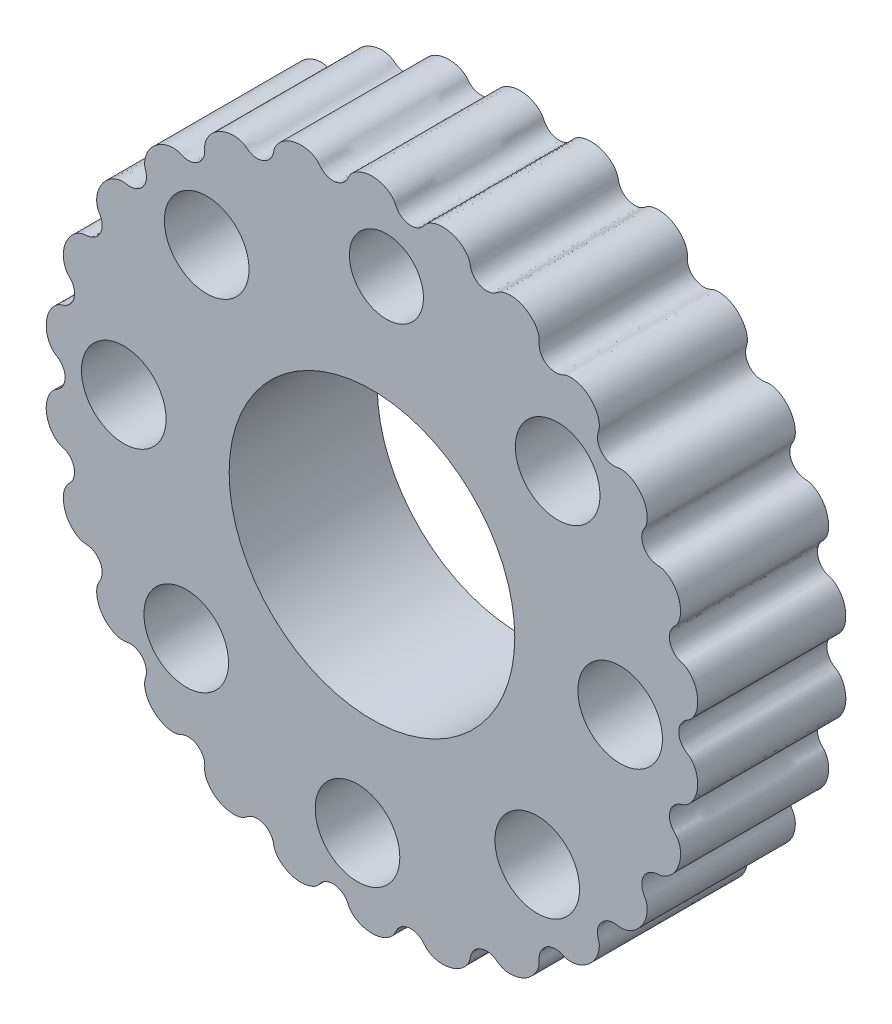
from build123d import *

# Parameters (mm, degrees)
SKETCH1_R        = 4
SKETCH1_R_2      = 13.5
EXTRUSION1_DEPTH = 14
EXTRUSION2_START = -5
SKETCH2_R        = 4
SKETCH2_R_2      = 3.5
EXTRUSION2_DEPTH = 5


with BuildPart() as part:
    # Sketch1 → Extrusion1 (new body)
    with BuildSketch(Plane.XY):
        with BuildLine():
            add(Edge.make_bspline(
                [(29, 0), (29, -0.376789204), (29.153513259, -0.703229563), (29.280402525, -0.883905996), (29.495133495, -1.189659407), (29.623510818, -1.242583836), (29.700019426, -1.295833756), (29.854226598, -1.403161804), (29.88265414, -1.412994243), (29.934648255, -1.448461782), (30.057359745, -1.532168844), (30.226573766, -1.667269836), (30.408052145, -1.955494437), (30.663331992, -2.360930792), (30.861446732, -3.06680081), (30.770659289, -3.762971134), (30.689739184, -4.383477382), (30.390255046, -4.954513185), (30.079404167, -5.289719413), (29.850529622, -5.536526414), (29.636586178, -5.660425735), (29.495438805, -5.723227119), (29.422146843, -5.755837266), (29.378667255, -5.76961159), (29.272559274, -5.805016474), (29.218748124, -5.822971556), (29.153849, -5.834396348), (28.970346246, -5.927674104), (28.848691254, -5.989513529), (28.638295722, -6.083579397), (28.402421601, -6.410574806), (28.230156467, -6.649388237), (28.101415723, -7.043920043), (28.114039967, -7.36632783), (28.13003751, -7.774885561), (28.272102362, -8.005844612), (28.356127129, -8.139006604), (28.505739094, -8.37611083), (28.568168114, -8.412323093), (28.612595809, -8.458659561), (28.711235488, -8.561537154), (28.744398474, -8.593760135), (28.808819097, -8.681895487), (28.948574282, -8.873097803), (29.151409878, -9.278419137), (29.175326567, -9.843287507), (29.201561715, -10.46291363), (28.968447422, -11.222843927), (28.567285081, -11.744523122), (28.224165345, -12.1907226), (27.796219964, -12.449058071), (27.512031378, -12.550259379), (27.358832379, -12.604814488), (27.25436537, -12.621049722), (27.158265381, -12.631046232), (27.099367254, -12.637172931), (27.067709293, -12.631488341), (26.873148531, -12.658460721), (26.788179826, -12.670240117), (26.665632167, -12.675675152), (26.416933975, -12.786433586), (26.232928362, -12.868380998), (25.946653249, -13.043759284), (25.740420799, -13.36934038), (25.544926925, -13.677968382), (25.489822974, -14.056912498), (25.506535744, -14.297475966), (25.533815346, -14.690138321), (25.631337693, -14.820256217), (25.67726007, -14.913047886), (25.767155033, -15.094691436), (25.790803082, -15.117574356), (25.819020041, -15.168683178), (25.885780874, -15.289605762), (25.95872212, -15.440829308), (26.000279455, -15.72147703), (26.063492675, -16.148372702), (25.978321637, -16.838256473), (25.624035928, -17.435865816), (25.273534038, -18.02709261), (24.684736969, -18.474969864), (24.204873828, -18.651888643), (23.850532913, -18.782529145), (23.58391245, -18.786530914), (23.423692808, -18.772306679), (23.353178507, -18.766046447), (23.313475257, -18.757998242), (23.193003065, -18.739109801), (23.130493718, -18.729309164), (23.057050179, -18.70439141), (22.817016308, -18.712748042), (22.665973243, -18.718006514), (22.411735467, -18.728224886), (22.074129263, -18.927651904), (21.803689676, -19.087402998), (21.537010762, -19.406590813), (21.426735852, -19.688830845), (21.270305731, -20.08920154), (21.316386948, -20.33233582), (21.33515342, -20.472892432), (21.369718287, -20.731775427), (21.400821881, -20.775045), (21.417284821, -20.831424873), (21.455421255, -20.96202896), (21.476017723, -21.033714564), (21.487059708, -21.194003219), (21.507665593, -21.493124234), (21.431991893, -22.035100014), (21.10046464, -22.56382238), (20.752479983, -23.118791147), (20.128266089, -23.598189384), (19.544493143, -23.790530755), (19.083278307, -23.942491709), (18.676784908, -23.930558237), (18.43738774, -23.882676974), (18.318275954, -23.858853706), (18.241679923, -23.831464215), (18.164838876, -23.800204857), (18.115287483, -23.78004708), (18.082088593, -23.759876823), (17.930173703, -23.703609039), (17.850190596, -23.673984081), (17.742072817, -23.617835381), (17.451890523, -23.598582777), (17.253236248, -23.585402744), (16.923751511, -23.605534598), (16.591139818, -23.793192282), (16.282780206, -23.967167077), (16.05488253, -24.265673436), (15.953178452, -24.485269327), (15.786354747, -24.84546924), (15.809506746, -25.014628377), (15.806088543, -25.121749654), (15.799481943, -25.328790473), (15.81061611, -25.361861802), (15.812109447, -25.418971328), (15.815641201, -25.554035759), (15.812406055, -25.704405001), (15.732664746, -25.953731572), (15.607596852, -26.344780447), (15.243418072, -26.912408891), (14.671037963, -27.292431394), (14.124718948, -27.655151056), (13.42767167, -27.814510539), (12.907715387, -27.778307624), (12.495865692, -27.74963183), (12.212478405, -27.625271416), (12.057583055, -27.532907426), (11.988100522, -27.49147504), (11.948201973, -27.461630149), (11.870914875, -27.403273336), (11.823322443, -27.367337937), (11.788753906, -27.319248435), (11.557639229, -27.198239248), (11.43929978, -27.13627797), (11.250146468, -27.031373812), (10.886678744, -27.017194857), (10.598987922, -27.005971975), (10.201432566, -27.111664102), (9.935629849, -27.301878904), (9.626564783, -27.523053281), (9.501689158, -27.761846503), (9.432870859, -27.908688978), (9.30095485, -28.190167505), (9.309619898, -28.270298288), (9.295631034, -28.337455332), (9.264435305, -28.487218252), (9.258552966, -28.527575136), (9.224995758, -28.627127141), (9.152563358, -28.842007673), (8.951268439, -29.22455999), (8.521291306, -29.564825082), (8.051312694, -29.936745595), (7.321670629, -30.195315854), (6.666548374, -30.18551273), (6.149536286, -30.17777626), (5.701998643, -30.01979544), (5.427983165, -29.85547943), (5.231722981, -29.737790128), (5.125408156, -29.631831284), (5.048933185, -29.544996261), (5.010375025, -29.501214633), (4.989516803, -29.470409418), (4.8984967, -29.364093053), (4.848368887, -29.305541078), (4.796999006, -29.214894746), (4.548899507, -29.046357174), (4.399181678, -28.944651691), (4.136411234, -28.798161464), (3.755673, -28.779285334), (3.414405592, -28.762366078), (3.042716869, -28.891985111), (2.824551091, -29.038709227), (2.484387171, -29.26748136), (2.405597414, -29.447359704), (2.344575844, -29.549095179), (2.22972714, -29.740571529), (2.224096245, -29.781013939), (2.199893849, -29.831433208), (2.143040371, -29.949872339), (2.090804872, -30.050667939), (1.948163151, -30.209644586), (1.704155366, -30.48159545), (1.181104411, -30.83769535), (0.518371049, -30.95472865), (-0.143255115, -31.071566429), (-0.891215069, -30.925579479), (-1.383857125, -30.651354116), (-1.724356119, -30.461818004), (-1.942342037, -30.234234972), (-2.058694069, -30.072741656), (-2.132811533, -29.969868721), (-2.164149671, -29.907017862), (-2.210380122, -29.809426793), (-2.229700089, -29.768642932), (-2.247192336, -29.723553138), (-2.308596707, -29.611786605), (-2.353963805, -29.529210671), (-2.403608644, -29.398358825), (-2.648504122, -29.176526635), (-2.811364542, -29.029003764), (-3.114843055, -28.83641096), (-3.489126798, -28.789352791), (-3.851241679, -28.743824595), (-4.188506196, -28.847742856), (-4.384723272, -28.948769214), (-4.717099561, -29.119899915), (-4.791674777, -29.244772824), (-4.856233022, -29.316051809), (-4.983929976, -29.457042464), (-4.997746831, -29.485760536), (-5.036905099, -29.53118873), (-5.133461533, -29.643205544), (-5.275985883, -29.78775877), (-5.572511333, -29.934209596), (-5.981254164, -30.136083415), (-6.669097215, -30.263104747), (-7.337150557, -30.118112097), (-8.005422406, -29.973072023), (-8.599322793, -29.565327432), (-8.90670342, -29.186424709), (-9.108385875, -28.937814273), (-9.197225057, -28.722791811), (-9.23961282, -28.581181709), (-9.25829201, -28.518777803), (-9.268174338, -28.472926288), (-9.283174683, -28.39863402), (-9.292241027, -28.3537311), (-9.298811144, -28.302862183), (-9.334414747, -28.175648604), (-9.36147998, -28.078943076), (-9.383274666, -27.927568033), (-9.586375382, -27.648595316), (-9.724085585, -27.459440937), (-10.002669302, -27.203566404), (-10.358057207, -27.08939079), (-10.712288342, -26.975586811), (-11.047428124, -27.018036104), (-11.247271358, -27.074370779), (-11.607160156, -27.175821391), (-11.690494591, -27.273289118), (-11.763091617, -27.324129438), (-11.91443087, -27.430113614), (-11.9326436, -27.451277308), (-11.990494242, -27.490297087), (-12.126510685, -27.582039053), (-12.364031199, -27.711242846), (-12.762304293, -27.763719538), (-13.262518248, -27.829628016), (-13.979986828, -27.712548347), (-14.561666645, -27.361677552), (-15.142387956, -27.01138493), (-15.544189918, -26.459983693), (-15.698654591, -26.05121109), (-15.795993367, -25.793615459), (-15.811648643, -25.609789997), (-15.812728579, -25.480621977), (-15.813143796, -25.430958983), (-15.811194859, -25.390583128), (-15.808098369, -25.314809119), (-15.80603082, -25.264214284), (-15.798697321, -25.203924251), (-15.809876958, -25.048307991), (-15.818162357, -24.932978399), (-15.817266226, -24.750262954), (-15.978009681, -24.434133715), (-16.092933598, -24.208116362), (-16.34396621, -23.916340633), (-16.652752822, -23.760262264), (-17.009927335, -23.57972589), (-17.333182061, -23.58392321), (-17.521203248, -23.604713619), (-17.853387005, -23.641444778), (-17.932654993, -23.703306136), (-18.00367317, -23.732275098), (-18.156071724, -23.794439858), (-18.183843461, -23.810305706), (-18.262019218, -23.836355439), (-18.440426314, -23.895804269), (-18.775676263, -23.962903754), (-19.236779227, -23.871624394), (-19.773156003, -23.765443924), (-20.426775322, -23.406126011), (-20.85810381, -22.895418828), (-21.286151212, -22.388596558), (-21.47085206, -21.779570597), (-21.488930141, -21.394614583), (-21.500621317, -21.145661823), (-21.468865946, -21.013759747), (-21.431565807, -20.881029713), (-21.419598524, -20.838444941), (-21.405336227, -20.798008705), (-21.378065716, -20.691137708), (-21.358368957, -20.613947657), (-21.314606088, -20.512619306), (-21.320946107, -20.221114476), (-21.325157041, -20.027501856), (-21.367726323, -19.699302641), (-21.596507682, -19.37075596), (-21.805015671, -19.071323315), (-22.144668616, -18.865630978), (-22.383630568, -18.788290041), (-22.775331784, -18.661514466), (-22.938900049, -18.709912643), (-23.044907923, -18.72000009), (-23.244105229, -18.738955212), (-23.275722221, -18.753159272), (-23.332294806, -18.761415327), (-23.470632783, -18.781604011), (-23.633917403, -18.796910673), (-23.910368317, -18.73778214), (-24.317955011, -18.650605712), (-24.911212213, -18.348260848), (-25.344006425, -17.831383438), (-25.776274137, -17.315134817), (-26.009005348, -16.620732001), (-26.022312378, -16.099736428), (-26.030488039, -15.779643688), (-25.971521912, -15.531144499), (-25.912768729, -15.372231853), (-25.879445986, -15.282102182), (-25.848804962, -15.221918981), (-25.813525479, -15.158792832), (-25.79076123, -15.118060394), (-25.767720937, -15.0833216), (-25.712862173, -14.981763959), (-25.678735759, -14.918587213), (-25.623775022, -14.838440372), (-25.560344984, -14.609836108), (-25.515341819, -14.447642989), (-25.45606319, -14.173517302), (-25.552037739, -13.803688322), (-25.638692263, -13.469773193), (-25.891757905, -13.130612652), (-26.118413124, -12.961295021), (-26.446587443, -12.716139852), (-26.652479534, -12.698358105), (-26.773903808, -12.674868854), (-26.998785053, -12.631366088), (-27.042788745, -12.641056046), (-27.098481374, -12.636501344), (-27.234209956, -12.625401073), (-27.335712061, -12.614944718), (-27.526823798, -12.544915294), (-27.851146092, -12.426073282), (-28.353695378, -12.095384857), (-28.706603378, -11.546591504), (-29.06035764, -10.99648216), (-29.221901536, -10.261461854), (-29.164411473, -9.690095777), (-29.116641163, -9.215329648), (-28.946347537, -8.875733747), (-28.821278154, -8.699208681), (-28.761199142, -8.614412136), (-28.719790087, -8.569916158), (-28.650828294, -8.498340774), (-28.617066481, -8.463299418), (-28.577830967, -8.430353535), (-28.479946744, -8.310527477), (-28.415974196, -8.232214772), (-28.307335635, -8.12424224), (-28.199217347, -7.814438004), (-28.123005002, -7.596057676), (-28.071043132, -7.229002615), (-28.174726822, -6.87560927), (-28.282711502, -6.50755652), (-28.517068857, -6.249167235), (-28.680068264, -6.116174749), (-28.96041353, -5.887438862), (-29.085822206, -5.872195266), (-29.168080895, -5.841573506), (-29.337012176, -5.778686858), (-29.366231414, -5.775040483), (-29.428891311, -5.75083548), (-29.575851639, -5.694065916), (-29.800298383, -5.583648839), (-30.060367543, -5.309997757), (-30.393485756, -4.959482689), (-30.716850495, -4.333209538), (-30.781775017, -3.665272415), (-30.845824216, -3.00634053), (-30.65602066, -2.355101486), (-30.415698666, -1.967728855), (-30.277120915, -1.744356755), (-30.13509608, -1.604275471), (-30.03007677, -1.519291986), (-29.957369662, -1.460456107), (-29.916605658, -1.435631903), (-29.813666622, -1.37061783), (-29.766710644, -1.340961449), (-29.708025916, -1.314263856), (-29.557868822, -1.186841016), (-29.455260582, -1.099767985), (-29.272385362, -0.963203143), (-29.116117525, -0.584778374), (-29.000884912, -0.305726228), (-28.969803973, 0.125948685), (-29.065388195, 0.442485153), (-29.184052374, 0.835453149), (-29.377333441, 1.019376249), (-29.489749135, 1.125797953), (-29.690366917, 1.315718822), (-29.757206414, 1.334920749), (-29.810603818, 1.368682388), (-29.929768192, 1.444026587), (-29.971689203, 1.468878417), (-30.058370404, 1.542800073), (-30.243927978, 1.701043417), (-30.54151476, 2.059991498), (-30.694284834, 2.614224595), (-30.861323307, 3.220221883), (-30.801284883, 4.017880871), (-30.526869714, 4.613201454), (-30.289365399, 5.128447049), (-29.928196364, 5.469300484), (-29.68153631, 5.623716451), (-29.575145044, 5.690320305), (-29.492430437, 5.726810499), (-29.419145192, 5.754562991), (-29.361545051, 5.776375669), (-29.327692281, 5.783104484), (-29.180206176, 5.837097496), (-29.109781404, 5.862879217), (-29.010074318, 5.88508112), (-28.793211902, 6.031980364), (-28.6485518, 6.129970877), (-28.42112486, 6.310060413), (-28.259066262, 6.65362343), (-28.115026168, 6.958987354), (-28.09008166, 7.358682651), (-28.14604737, 7.623810648), (-28.233016296, 8.035811085), (-28.378672015, 8.181444066), (-28.45394424, 8.277958096), (-28.596223142, 8.460388073), (-28.632573095, 8.479048758), (-28.671514566, 8.519909872), (-28.762970552, 8.615874231), (-28.838162873, 8.699534929), (-28.936455769, 8.889221435), (-29.106812244, 9.217976878), (-29.255848082, 9.847598949), (-29.121664872, 10.519348259), (-28.987564861, 11.190681059), (-28.56740915, 11.841350341), (-28.129487583, 12.195502904), (-27.780573832, 12.47767375), (-27.461018124, 12.580313829), (-27.27527929, 12.614447663), (-27.199624067, 12.628351071), (-27.150829028, 12.632435802), (-27.058014802, 12.639711166), (-27.00151509, 12.644139969), (-26.943305829, 12.636091875), (-26.723316859, 12.685427116), (-26.6026533, 12.712487408), (-26.409624397, 12.747329453), (-26.128422509, 12.953880477), (-25.910944679, 13.113624314), (-25.662798484, 13.427513535), (-25.566322816, 13.752334315), (-25.452954535, 14.134030287), (-25.511376242, 14.428267343), (-25.557174596, 14.598242149), (-25.63761469, 14.896785406), (-25.701254959, 14.96199933), (-25.736666763, 15.024871352), (-25.812643968, 15.159765371), (-25.832711467, 15.188601008), (-25.86858561, 15.265908818), (-25.95180307, 15.4452402), (-26.061021603, 15.796670594), (-26.009969417, 16.290275064), (-25.951468756, 16.855896049), (-25.638772006, 17.555314201), (-25.162283149, 18.029466008), (-24.748728938, 18.440991847), (-24.24642911, 18.669333848), (-23.89197135, 18.741625677), (-23.653710104, 18.790219172), (-23.49403235, 18.781678219), (-23.375015124, 18.767162962), (-23.315572934, 18.759913435), (-23.280311537, 18.750630578), (-23.137565616, 18.73089565), (-23.061042331, 18.720316143), (-22.962061884, 18.686556057), (-22.664548487, 18.725245809), (-22.484723827, 18.748630879), (-22.190520146, 18.8138919), (-21.893470913, 19.052646676), (-21.626951442, 19.266863007), (-21.435540536, 19.610440168), (-21.36995716, 19.864601166), (-21.267593511, 20.261299971), (-21.327982031, 20.447618467), (-21.349786939, 20.563994202), (-21.390832203, 20.783058317), (-21.413355093, 20.816991437), (-21.428664725, 20.870774772), (-21.464631811, 20.997128553), (-21.492452324, 21.107715369), (-21.490910217, 21.321951179), (-21.488278104, 21.687615204), (-21.332419784, 22.300574747), (-20.914098226, 22.82707231), (-20.496872099, 23.352191169), (-19.841777334, 23.738304129), (-19.291903219, 23.860064829), (-18.924188821, 23.941489216), (-18.617245176, 23.920560063), (-18.422408764, 23.879604969), (-18.31563017, 23.857159846), (-18.243553296, 23.831836435), (-18.173556833, 23.803728826), (-18.130392891, 23.786396018), (-18.093787939, 23.768849924), (-17.999094408, 23.73041191), (-17.92817914, 23.701625972), (-17.846767922, 23.641691775), (-17.525942455, 23.605244833), (-17.345331763, 23.584726801), (-17.042466604, 23.57739302), (-16.695375411, 23.739540695), (-16.385650533, 23.884232262), (-16.118572277, 24.171891566), (-15.994502316, 24.402601032), (-15.801287793, 24.761885575), (-15.814885759, 24.956858471), (-15.808159699, 25.074992256), (-15.795544122, 25.296567105), (-15.809226093, 25.335448685), (-15.811235377, 25.391185584), (-15.81594861, 25.521929151), (-15.81661578, 25.633771899), (-15.76557369, 25.838231515), (-15.678418206, 26.187350782), (-15.38935816, 26.738476294), (-14.866909812, 27.150554528), (-14.345665583, 27.56168302), (-13.625065441, 27.789169095), (-13.059243608, 27.784206894), (-12.699360044, 27.781050751), (-12.40959978, 27.699749511), (-12.22295316, 27.617771279), (-12.088985747, 27.558930611), (-12.012415962, 27.507785565), (-11.935379801, 27.451475288), (-11.89957228, 27.425301457), (-11.867671351, 27.398850043), (-11.78411078, 27.339017082), (-11.72485787, 27.296589452), (-11.65447184, 27.228848894), (-11.411755341, 27.130671047), (-11.251421739, 27.06581675), (-10.97525545, 26.974485588), (-10.591009136, 27.034225453), (-10.245095457, 27.088005634), (-9.886721339, 27.30723371), (-9.699148999, 27.510999828), (-9.422955251, 27.81103835), (-9.386355398, 28.006730408), (-9.350491864, 28.121355102), (-9.283595069, 28.335166289), (-9.287629251, 28.377653166), (-9.276328264, 28.432202636), (-9.248619946, 28.565949724), (-9.222912155, 28.675415127), (-9.119915077, 28.867977144), (-8.949932482, 29.185774426), (-8.538283511, 29.646741189), (-7.937079008, 29.919616823), (-7.336306535, 30.192296368), (-6.58767896, 30.242266848), (-6.040570614, 30.10466661), (-5.614070166, 29.997399807), (-5.322579412, 29.803931331), (-5.168650159, 29.66592866), (-5.09200491, 29.597213657), (-5.050374214, 29.548840834), (-4.992991306, 29.478663173), (-4.962876994, 29.441834229), (-4.936434411, 29.401984589), (-4.837846061, 29.296019422), (-4.775916492, 29.229456008), (-4.695712644, 29.124026378), (-4.441848526, 28.979698039), (-4.260308077, 28.876487582), (-3.941762372, 28.754072863), (-3.56794143, 28.78151104), (-3.197466652, 28.808703611), (-2.868927436, 28.989558501), (-2.690954424, 29.139445162), (-2.393105298, 29.390289998), (-2.349772761, 29.535692131), (-2.302761238, 29.622483952), (-2.20886408, 29.795835184), (-2.203550235, 29.82579248), (-2.175867732, 29.88018106), (-2.11046229, 30.008684946), (-2.009773476, 30.177613031), (-1.768150686, 30.385191874), (-1.415577805, 30.688088264), (-0.752418447, 30.988774256), (-0.046167636, 30.999644728), (0.592266715, 31.009471383), (1.219510345, 30.785204282), (1.605011517, 30.51235251), (1.891097503, 30.309865272), (2.045930615, 30.104725908), (2.127116658, 29.968736277), (2.167438181, 29.901196229), (2.186602044, 29.859458673), (2.233005038, 29.76152411), (2.257355256, 29.710132427), (2.275725221, 29.64749951), (2.392614611, 29.47339957), (2.467027217, 29.362566327), (2.581908309, 29.173501841), (2.917495722, 28.980878823), (3.168004516, 28.837089878), (3.570530407, 28.746735558), (3.894196472, 28.792482835), (4.296685945, 28.849371089), (4.518598116, 29.016680122), (4.645208022, 29.117156834), (4.869888815, 29.295461895), (4.900400795, 29.365411925), (4.942187589, 29.416317379), (5.034218341, 29.528430961), (5.059850792, 29.562818103), (5.133890892, 29.633725391), (5.297447577, 29.790361604), (5.653420861, 30.036407331), (6.193533924, 30.138262765), (6.787121194, 30.250202456), (7.56080253, 30.136873657), (8.138149347, 29.818829343), (8.581443665, 29.574630824), (8.897838497, 29.23499257), (9.063487098, 28.966067258), (9.18165652, 28.774222905), (9.228771833, 28.629915123), (9.256579828, 28.51949661), (9.272107014, 28.457842082), (9.275055696, 28.42350385), (9.309657797, 28.273192334), (9.327096963, 28.197436599), (9.331152725, 28.091834709), (9.473647564, 27.82769558), (9.560207198, 27.667242144), (9.727681559, 27.414950204), (10.056909547, 27.223458982), (10.353094853, 27.051186612), (10.741565015, 26.996366299), (11.001162027, 27.025939364), (11.407533903, 27.072232894), (11.558749341, 27.1944073), (11.659183654, 27.255867397), (11.848352182, 27.371627795), (11.871971738, 27.404431533), (11.916832906, 27.437793645), (12.022261653, 27.516198328), (12.117104247, 27.582173773), (12.319996567, 27.656847025), (12.664297564, 27.783564857), (13.292839116, 27.853335393), (13.932250402, 27.648073894), (14.568901864, 27.443698344), (15.159421893, 26.969881), (15.467654163, 26.500496006), (15.659825574, 26.207851836), (15.751543918, 25.931415117), (15.787604242, 25.737120609), (15.813498746, 25.597599956), (15.814641251, 25.508390037), (15.811972558, 25.413941053), (15.810730864, 25.369995665), (15.807069113, 25.328551417), (15.805393111, 25.226148408), (15.804179271, 25.151983315), (15.7873494, 25.05356127), (15.848551533, 24.790228208), (15.888635603, 24.617759368), (15.977450228, 24.332208035), (16.252246132, 24.052811244), (16.500029195, 23.800879567), (16.883970695, 23.641332385), (17.153354448, 23.60733672), (17.555385218, 23.55660128), (17.730538136, 23.637926529), (17.842431172, 23.673409624), (18.05215936, 23.739917832), (18.083766447, 23.766279926), (18.135066232, 23.787868373), (18.260697305, 23.840737595), (18.372012121, 23.883670807), (18.597896167, 23.906652225), (18.963986255, 23.94389819), (19.58182752, 23.857177181), (20.144851752, 23.50995364), (20.726503476, 23.15124231), (21.191774557, 22.530343728), (21.37240243, 21.993317545), (21.51231617, 21.577338879), (21.502051841, 21.242345513), (21.470701674, 21.052896276), (21.455936181, 20.963668318), (21.441653252, 20.91493797), (21.411311027, 20.810976441), (21.396040953, 20.758656602), (21.370577153, 20.704114298), (21.340293152, 20.508535286), (21.321717047, 20.388567782), (21.28105173, 20.199338227), (21.37268296, 19.854187676), (21.443156605, 19.58873214), (21.654701782, 19.230742735), (21.933743468, 19.021367021), (22.254107694, 18.780985416), (22.548706875, 18.734993043), (22.722364767, 18.718793861), (23.027794823, 18.690302688), (23.109111501, 18.726245696), (23.179524642, 18.737021226), (23.331364546, 18.760257733), (23.366301479, 18.768774906), (23.453813913, 18.774656509), (23.655700667, 18.788225069), (24.034486714, 18.761478442), (24.484384746, 18.528096714), (24.987179246, 18.267275281), (25.516427984, 17.72992395), (25.784568682, 17.124692357), (26.034421704, 16.560738643), (26.054389766, 15.98118336), (25.983955408, 15.627199703), (25.93824624, 15.397478032), (25.876945456, 15.272978571), (25.816485337, 15.164105626), (25.795349021, 15.12604462), (25.773814482, 15.091757373), (25.728534405, 15.01034342), (25.695222559, 14.950448444), (25.640906458, 14.879361146), (25.569802117, 14.642575819), (25.523697247, 14.4890415), (25.457187963, 14.231317448), (25.538420004, 13.860612761), (25.610866156, 13.530002724), (25.852159498, 13.171636715), (26.083072201, 12.988500473), (26.407274822, 12.731376248), (26.624500014, 12.705657793), (26.751105714, 12.679434353), (26.983700433, 12.631257741), (27.030982702, 12.64190545), (27.087317817, 12.637403241), (27.217776505, 12.6269772), (27.302684737, 12.618898166), (27.467056974, 12.565565056), (27.768649791, 12.467708611), (28.260881462, 12.178795965), (28.630768295, 11.658690446), (29.001460154, 11.137452963), (29.203853989, 10.413047322), (29.174387587, 9.822933994), (29.150775545, 9.350063893), (29.000317503, 8.982726488), (28.872952639, 8.77720065), (28.80852858, 8.673240983), (28.755018636, 8.609811649), (28.699503989, 8.54969935), (28.669134773, 8.516814995), (28.640063318, 8.48874736), (28.575255084, 8.419221478), (28.527612321, 8.36811061), (28.45538984, 8.313194125), (28.323398012, 8.084843835), (28.24092458, 7.94216203), (28.114652627, 7.697481464), (28.112882147, 7.313407763), (28.111301224, 6.9704548), (28.269825348, 6.57261128), (28.4502273, 6.347759547), (28.707970046, 6.026510785), (28.907371612, 5.956119728), (29.021366479, 5.902786247), (29.23175097, 5.804356048), (29.278019071, 5.803312496), (29.331212991, 5.785537568), (29.460376133, 5.742377268), (29.552018589, 5.709870289), (29.716067657, 5.601503494), (29.996607113, 5.416186004), (30.402321802, 4.990358438), (30.620458512, 4.384591576), (30.843511302, 3.765172736), (30.834342658, 3.000421818), (30.642754999, 2.448412257), (30.486542596, 1.998327215), (30.241623115, 1.704057531), (30.076359327, 1.55839712), (29.993727432, 1.485566915), (29.940583244, 1.450626754), (29.855027721, 1.396665019), (29.81224996, 1.369684152), (29.765950817, 1.348657309), (29.629385223, 1.244386394), (29.550532024, 1.184180197), (29.426925187, 1.103473897), (29.260661084, 0.855118407), (29.138972937, 0.673347843), (29, 0.357362991), (29, 0)],
                knots=[0, 0, 0, 0, 0.27327128, 0.27327128, 0.27327128, 0.735720224, 0.735720224, 0.735720224, 1.667810689, 1.667810689, 1.667810689, 3.867640605, 3.867640605, 3.867640605, 6.962071187, 6.962071187, 6.962071187, 9.720180006, 9.720180006, 9.720180006, 11.750931547, 11.750931547, 11.750931547, 12.805416376, 12.805416376, 12.805416376, 13.340183332, 13.340183332, 13.340183332, 13.694712449, 13.694712449, 13.694712449, 13.953634478, 13.953634478, 13.953634478, 14.281742547, 14.281742547, 14.281742547, 14.865961877, 14.865961877, 14.865961877, 16.163062891, 16.163062891, 16.163062891, 18.977015681, 18.977015681, 18.977015681, 22.063750132, 22.063750132, 22.063750132, 24.703877084, 24.703877084, 24.703877084, 26.12710387, 26.12710387, 26.12710387, 26.999376521, 26.999376521, 26.999376521, 27.380316011, 27.380316011, 27.380316011, 27.662163673, 27.662163673, 27.662163673, 27.929335455, 27.929335455, 27.929335455, 28.365429521, 28.365429521, 28.365429521, 29.219101794, 29.219101794, 29.219101794, 31.238875534, 31.238875534, 31.238875534, 34.311170798, 34.311170798, 34.311170798, 37.35065353, 37.35065353, 37.35065353, 39.595070736, 39.595070736, 39.595070736, 40.582861675, 40.582861675, 40.582861675, 41.095396274, 41.095396274, 41.095396274, 41.417912412, 41.417912412, 41.417912412, 41.676264095, 41.676264095, 41.676264095, 42.04274805, 42.04274805, 42.04274805, 42.717753387, 42.717753387, 42.717753387, 44.281404563, 44.281404563, 44.281404563, 47.199396046, 47.199396046, 47.199396046, 50.262240061, 50.262240061, 50.262240061, 52.68206631, 52.68206631, 52.68206631, 53.886048084, 53.886048084, 53.886048084, 54.662442685, 54.662442685, 54.662442685, 55.071214023, 55.071214023, 55.071214023, 55.351052508, 55.351052508, 55.351052508, 55.610486823, 55.610486823, 55.610486823, 56.036033118, 56.036033118, 56.036033118, 56.858516347, 56.858516347, 56.858516347, 58.803694964, 58.803694964, 58.803694964, 61.85455274, 61.85455274, 61.85455274, 64.766501617, 64.766501617, 64.766501617, 67.073013323, 67.073013323, 67.073013323, 68.10766204, 68.10766204, 68.10766204, 68.74478582, 68.74478582, 68.74478582, 69.071017274, 69.071017274, 69.071017274, 69.329234961, 69.329234961, 69.329234961, 69.629480451, 69.629480451, 69.629480451, 70.205013232, 70.205013232, 70.205013232, 71.488474566, 71.488474566, 71.488474566, 74.258794008, 74.258794008, 74.258794008, 77.286840815, 77.286840815, 77.286840815, 79.676527305, 79.676527305, 79.676527305, 81.388110577, 81.388110577, 81.388110577, 82.251079216, 82.251079216, 82.251079216, 82.726344882, 82.726344882, 82.726344882, 83.013148135, 83.013148135, 83.013148135, 83.270218726, 83.270218726, 83.270218726, 83.671043002, 83.671043002, 83.671043002, 84.425434422, 84.425434422, 84.425434422, 86.19756373, 86.19756373, 86.19756373, 89.229028452, 89.229028452, 89.229028452, 92.255428643, 92.255428643, 92.255428643, 94.347183107, 94.347183107, 94.347183107, 95.679652626, 95.679652626, 95.679652626, 96.236499184, 96.236499184, 96.236499184, 96.64791147, 96.64791147, 96.64791147, 96.921508918, 96.921508918, 96.921508918, 97.186211056, 97.186211056, 97.186211056, 97.634595652, 97.634595652, 97.634595652, 98.521505556, 98.521505556, 98.521505556, 100.708447476, 100.708447476, 100.708447476, 103.723017825, 103.723017825, 103.723017825, 106.738574179, 106.738574179, 106.738574179, 108.717179068, 108.717179068, 108.717179068, 109.589099009, 109.589099009, 109.589099009, 110.116095319, 110.116095319, 110.116095319, 110.516708658, 110.516708658, 110.516708658, 110.788340121, 110.788340121, 110.788340121, 111.059087437, 111.059087437, 111.059087437, 111.546664248, 111.546664248, 111.546664248, 112.563090307, 112.563090307, 112.563090307, 114.952876385, 114.952876385, 114.952876385, 117.954345382, 117.954345382, 117.954345382, 120.950868485, 120.950868485, 120.950868485, 122.839183047, 122.839183047, 122.839183047, 123.565209152, 123.565209152, 123.565209152, 124.049981858, 124.049981858, 124.049981858, 124.409254331, 124.409254331, 124.409254331, 124.666117043, 124.666117043, 124.666117043, 124.963231006, 124.963231006, 124.963231006, 125.488152872, 125.488152872, 125.488152872, 126.614587499, 126.614587499, 126.614587499, 129.185255662, 129.185255662, 129.185255662, 132.175578446, 132.175578446, 132.175578446, 135.143154053, 135.143154053, 135.143154053, 137.062298345, 137.062298345, 137.062298345, 137.678031794, 137.678031794, 137.678031794, 138.122759535, 138.122759535, 138.122759535, 138.418140242, 138.418140242, 138.418140242, 138.687345904, 138.687345904, 138.687345904, 139.12862195, 139.12862195, 139.12862195, 139.957815067, 139.957815067, 139.957815067, 141.985456179, 141.985456179, 141.985456179, 144.97491831, 144.97491831, 144.97491831, 147.960743717, 147.960743717, 147.960743717, 149.795195074, 149.795195074, 149.795195074, 150.835631452, 150.835631452, 150.835631452, 151.506977805, 151.506977805, 151.506977805, 151.924607413, 151.924607413, 151.924607413, 152.220912684, 152.220912684, 152.220912684, 152.488443942, 152.488443942, 152.488443942, 152.875802719, 152.875802719, 152.875802719, 153.593202304, 153.593202304, 153.593202304, 155.341577808, 155.341577808, 155.341577808, 158.308622964, 158.308622964, 158.308622964, 161.282783008, 161.282783008, 161.282783008, 163.754106576, 163.754106576, 163.754106576, 164.941245048, 164.941245048, 164.941245048, 165.522435667, 165.522435667, 165.522435667, 165.902274659, 165.902274659, 165.902274659, 166.170022335, 166.170022335, 166.170022335, 166.448876676, 166.448876676, 166.448876676, 166.928482682, 166.928482682, 166.928482682, 167.913429767, 167.913429767, 167.913429767, 170.223490153, 170.223490153, 170.223490153, 173.182407649, 173.182407649, 173.182407649, 176.10143253, 176.10143253, 176.10143253, 177.784640539, 177.784640539, 177.784640539, 178.949961331, 178.949961331, 178.949961331, 179.481526219, 179.481526219, 179.481526219, 179.844765382, 179.844765382, 179.844765382, 180.112619593, 180.112619593, 180.112619593, 180.445150417, 180.445150417, 180.445150417, 181.038587098, 181.038587098, 181.038587098, 182.362930697, 182.362930697, 182.362930697, 185.197939711, 185.197939711, 185.197939711, 188.297732526, 188.297732526, 188.297732526, 190.980580455, 190.980580455, 190.980580455, 192.137766567, 192.137766567, 192.137766567, 193.047282296, 193.047282296, 193.047282296, 193.481577022, 193.481577022, 193.481577022, 193.771277379, 193.771277379, 193.771277379, 194.02876737, 194.02876737, 194.02876737, 194.42889859, 194.42889859, 194.42889859, 195.185223125, 195.185223125, 195.185223125, 196.961488953, 196.961488953, 196.961488953, 200.040026649, 200.040026649, 200.040026649, 203.116655537, 203.116655537, 203.116655537, 205.567957794, 205.567957794, 205.567957794, 206.566423299, 206.566423299, 206.566423299, 207.17422897, 207.17422897, 207.17422897, 207.5076093, 207.5076093, 207.5076093, 207.76544125, 207.76544125, 207.76544125, 208.068418837, 208.068418837, 208.068418837, 208.600567795, 208.600567795, 208.600567795, 209.742311133, 209.742311133, 209.742311133, 212.390819859, 212.390819859, 212.390819859, 215.425743981, 215.425743981, 215.425743981, 218.059815336, 218.059815336, 218.059815336, 219.830399005, 219.830399005, 219.830399005, 220.714702676, 220.714702676, 220.714702676, 221.188760509, 221.188760509, 221.188760509, 221.475293113, 221.475293113, 221.475293113, 221.732376821, 221.732376821, 221.732376821, 222.133637444, 222.133637444, 222.133637444, 222.888965035, 222.888965035, 222.888965035, 224.663464485, 224.663464485, 224.663464485, 227.692232709, 227.692232709, 227.692232709, 230.713069703, 230.713069703, 230.713069703, 232.733177989, 232.733177989, 232.733177989, 233.840282767, 233.840282767, 233.840282767, 234.522988765, 234.522988765, 234.522988765, 235.034262116, 235.034262116, 235.034262116, 235.322086629, 235.322086629, 235.322086629, 235.578925218, 235.578925218, 235.578925218, 235.978900722, 235.978900722, 235.978900722, 236.729105356, 236.729105356, 236.729105356, 238.488880851, 238.488880851, 238.488880851, 241.493735993, 241.493735993, 241.493735993, 244.491665657, 244.491665657, 244.491665657, 246.398459547, 246.398459547, 246.398459547, 247.767079274, 247.767079274, 247.767079274, 248.403233513, 248.403233513, 248.403233513, 248.854331306, 248.854331306, 248.854331306, 249.152317367, 249.152317367, 249.152317367, 249.420576166, 249.420576166, 249.420576166, 249.815577919, 249.815577919, 249.815577919, 250.552380705, 250.552380705, 250.552380705, 252.358910223, 252.358910223, 252.358910223, 255.340340193, 255.340340193, 255.340340193, 258.319627693, 258.319627693, 258.319627693, 260.642142899, 260.642142899, 260.642142899, 261.798581669, 261.798581669, 261.798581669, 262.40547592, 262.40547592, 262.40547592, 262.78670453, 262.78670453, 262.78670453, 263.05932444, 263.05932444, 263.05932444, 263.32950406, 263.32950406, 263.32950406, 263.781666796, 263.781666796, 263.781666796, 264.684781469, 264.684781469, 264.684781469, 266.81857029, 266.81857029, 266.81857029, 269.932167619, 269.932167619, 269.932167619, 272.746787381, 272.746787381, 272.746787381, 274.835557339, 274.835557339, 274.835557339, 275.872957182, 275.872957182, 275.872957182, 276.417338274, 276.417338274, 276.417338274, 276.763895096, 276.763895096, 276.763895096, 277.022592317, 277.022592317, 277.022592317, 277.344290881, 277.344290881, 277.344290881, 277.915174236, 277.915174236, 277.915174236, 279.172481119, 279.172481119, 279.172481119, 281.949907732, 281.949907732, 281.949907732, 285.002315078, 285.002315078, 285.002315078, 287.345992732, 287.345992732, 287.345992732, 289.017911676, 289.017911676, 289.017911676, 289.951463217, 289.951463217, 289.951463217, 290.421965311, 290.421965311, 290.421965311, 290.707775589, 290.707775589, 290.707775589, 290.964900766, 290.964900766, 290.964900766, 291.367403242, 291.367403242, 291.367403242, 292.125518654, 292.125518654, 292.125518654, 293.907174371, 293.907174371, 293.907174371, 296.930580283, 296.930580283, 296.930580283, 299.940936591, 299.940936591, 299.940936591, 301.817782322, 301.817782322, 301.817782322, 303.165523673, 303.165523673, 303.165523673, 303.792603132, 303.792603132, 303.792603132, 304.246763674, 304.246763674, 304.246763674, 304.544214142, 304.544214142, 304.544214142, 304.812424791, 304.812424791, 304.812424791, 305.212704812, 305.212704812, 305.212704812, 305.962974945, 305.962974945, 305.962974945, 307.800355798, 307.800355798, 307.800355798, 310.778197432, 310.778197432, 310.778197432, 313.854560092, 313.854560092, 313.854560092, 316.237500207, 316.237500207, 316.237500207, 317.35983188, 317.35983188, 317.35983188, 317.924658238, 317.924658238, 317.924658238, 318.271120816, 318.271120816, 318.271120816, 318.537585432, 318.537585432, 318.537585432, 318.843510083, 318.843510083, 318.843510083, 319.381571337, 319.381571337, 319.381571337, 320.541854324, 320.541854324, 320.541854324, 323.218568433, 323.218568433, 323.218568433, 326.20999546, 326.20999546, 326.20999546, 328.997401803, 328.997401803, 328.997401803, 330.806320463, 330.806320463, 330.806320463, 331.438702217, 331.438702217, 331.438702217, 331.903935623, 331.903935623, 331.903935623, 332.205598293, 332.205598293, 332.205598293, 332.474633755, 332.474633755, 332.474633755, 332.852360928, 332.852360928, 332.852360928, 333.546305558, 333.546305558, 333.546305558, 335.153315761, 335.153315761, 335.153315761, 338.101883853, 338.101883853, 338.101883853, 341.05686924, 341.05686924, 341.05686924, 343.424760585, 343.424760585, 343.424760585, 344.62249416, 344.62249416, 344.62249416, 345.277712757, 345.277712757, 345.277712757, 345.759386494, 345.759386494, 345.759386494, 346.060354266, 346.060354266, 346.060354266, 346.329099011, 346.329099011, 346.329099011, 346.713058322, 346.713058322, 346.713058322, 347.42167869, 347.42167869, 347.42167869, 349.142319588, 349.142319588, 349.142319588, 352.084778602, 352.084778602, 352.084778602, 355.093550896, 355.093550896, 355.093550896, 357.546775448, 357.546775448, 357.546775448, 358.773387724, 358.773387724, 358.773387724, 359.386693862, 359.386693862, 359.386693862, 359.740817834, 359.740817834, 359.740817834, 360, 360, 360, 360], degree=3))
        make_face()
        with Locations((-17.555089174, -15.622702842)):
            Circle(SKETCH1_R, mode=Mode.SUBTRACT)
        with Locations((-1.366403479, -23.460241719)):
            Circle(SKETCH1_R, mode=Mode.SUBTRACT)
        with Locations((15.622702842, -17.555089174)):
            Circle(SKETCH1_R, mode=Mode.SUBTRACT)
        with Locations((23.460241719, -1.366403479)):
            Circle(SKETCH1_R, mode=Mode.SUBTRACT)
        with Locations((-23.460241719, 1.366403479)):
            Circle(SKETCH1_R, mode=Mode.SUBTRACT)
        Circle(SKETCH1_R_2, mode=Mode.SUBTRACT)
        with Locations((-15.622702842, 17.555089174)):
            Circle(SKETCH1_R, mode=Mode.SUBTRACT)
        with Locations((1.366403479, 23.460241719)):
            Circle(SKETCH1_R, mode=Mode.SUBTRACT)
        with Locations((17.555089174, 15.622702842)):
            Circle(SKETCH1_R, mode=Mode.SUBTRACT)
    extrude(amount=EXTRUSION1_DEPTH)

    # Sketch2 → Extrusion2 (add)
    with BuildSketch(Plane.XY.offset(14).offset(EXTRUSION2_START)):
        with Locations((1.366403479, 23.460241719)):
            Circle(SKETCH2_R)
        with Locations((1.366403479, 23.460241719)):
            Circle(SKETCH2_R_2, mode=Mode.SUBTRACT)
    extrude(amount=EXTRUSION2_DEPTH)


solid = part.part
